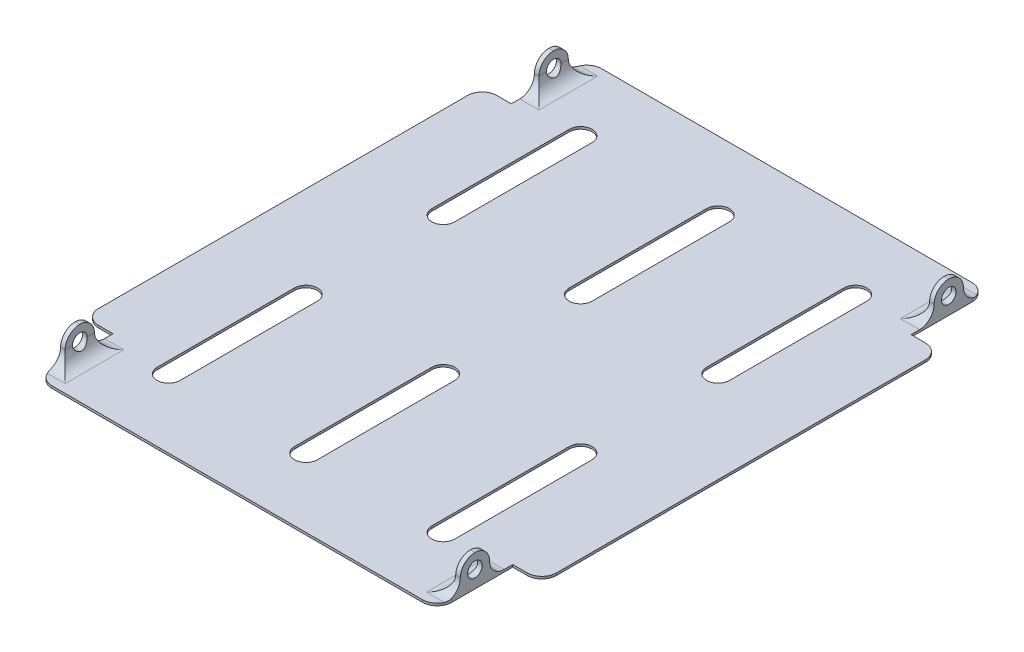
from build123d import *

# Parameters (mm, degrees)
BOSS_EXTRUDE1_DEPTH  = 5
CUT_EXTRUDE1_REACH   = 783.041
SKETCH3_W            = 64
SKETCH3_H            = 64
SKETCH3_R            = 16
BOSS_EXTRUDE2_DEPTH  = 10
FILLET1_R            = 32
FILLET1_OF_MIRROR1_R = 32
FILLET2_R            = 32


with BuildPart() as part:
    # Sketch1 → Boss-Extrude1 (new body)
    with BuildSketch(Plane(origin=(0, 0, 0), x_dir=(1, 0, 0), z_dir=(0, 1, 0))):
        Polygon((-436.5, -434.9), (-436.5, -600), (436.5, -600), (436.5, -434.9), (500, -434.9), (500, 434.9), (436.5, 434.9), (436.5, 600), (-436.5, 600), (-436.5, 434.9), (-500, 434.9), (-500, -434.9), align=None)
    extrude(amount=BOSS_EXTRUDE1_DEPTH)

    # Sketch2 → Cut-Extrude1 (cut, up to next)
    with BuildSketch(Plane(origin=(0, 5, 0), x_dir=(1, 0, 0), z_dir=(0, 1, 0)), mode=Mode.PRIVATE) as cut_extrude1_sk1:
        with BuildLine():
            Line((-275, -150), (-275, -450))
            ThreePointArc((-275, -450), (-300, -475), (-325, -450))
            Line((-325, -450), (-325, -150))
            ThreePointArc((-325, -150), (-300, -125), (-275, -150))
        make_face()
    cut_extrude1_tool1 = extrude(cut_extrude1_sk1.sketch, amount=-CUT_EXTRUDE1_REACH, mode=Mode.PRIVATE) & part.part
    # Sketch2 → Cut-Extrude1 (cut, up to next)
    with BuildSketch(Plane(origin=(0, 5, 0), x_dir=(1, 0, 0), z_dir=(0, 1, 0)), mode=Mode.PRIVATE) as cut_extrude1_sk2:
        with BuildLine():
            Line((-325, 150), (-325, 450))
            ThreePointArc((-325, 450), (-300, 475), (-275, 450))
            Line((-275, 450), (-275, 150))
            ThreePointArc((-275, 150), (-300, 125), (-325, 150))
        make_face()
    cut_extrude1_tool2 = extrude(cut_extrude1_sk2.sketch, amount=-CUT_EXTRUDE1_REACH, mode=Mode.PRIVATE) & part.part
    # Sketch2 → Cut-Extrude1 (cut, up to next)
    with BuildSketch(Plane(origin=(0, 5, 0), x_dir=(1, 0, 0), z_dir=(0, 1, 0)), mode=Mode.PRIVATE) as cut_extrude1_sk3:
        with BuildLine():
            Line((-25, 150), (-25, 450))
            ThreePointArc((-25, 450), (0, 475), (25, 450))
            Line((25, 450), (25, 150))
            ThreePointArc((25, 150), (0, 125), (-25, 150))
        make_face()
    cut_extrude1_tool3 = extrude(cut_extrude1_sk3.sketch, amount=-CUT_EXTRUDE1_REACH, mode=Mode.PRIVATE) & part.part
    # Sketch2 → Cut-Extrude1 (cut, up to next)
    with BuildSketch(Plane(origin=(0, 5, 0), x_dir=(1, 0, 0), z_dir=(0, 1, 0)), mode=Mode.PRIVATE) as cut_extrude1_sk4:
        with BuildLine():
            Line((25, -150), (25, -450))
            ThreePointArc((25, -450), (0, -475), (-25, -450))
            Line((-25, -450), (-25, -150))
            ThreePointArc((-25, -150), (0, -125), (25, -150))
        make_face()
    cut_extrude1_tool4 = extrude(cut_extrude1_sk4.sketch, amount=-CUT_EXTRUDE1_REACH, mode=Mode.PRIVATE) & part.part
    # Sketch2 → Cut-Extrude1 (cut, up to next)
    with BuildSketch(Plane(origin=(0, 5, 0), x_dir=(1, 0, 0), z_dir=(0, 1, 0)), mode=Mode.PRIVATE) as cut_extrude1_sk5:
        with BuildLine():
            Line((275, 150), (275, 450))
            ThreePointArc((275, 450), (300, 475), (325, 450))
            Line((325, 450), (325, 150))
            ThreePointArc((325, 150), (300, 125), (275, 150))
        make_face()
    cut_extrude1_tool5 = extrude(cut_extrude1_sk5.sketch, amount=-CUT_EXTRUDE1_REACH, mode=Mode.PRIVATE) & part.part
    # Sketch2 → Cut-Extrude1 (cut, up to next)
    with BuildSketch(Plane(origin=(0, 5, 0), x_dir=(1, 0, 0), z_dir=(0, 1, 0)), mode=Mode.PRIVATE) as cut_extrude1_sk6:
        with BuildLine():
            Line((325, -150), (325, -450))
            ThreePointArc((325, -450), (300, -475), (275, -450))
            Line((275, -450), (275, -150))
            ThreePointArc((275, -150), (300, -125), (325, -150))
        make_face()
    cut_extrude1_tool6 = extrude(cut_extrude1_sk6.sketch, amount=-CUT_EXTRUDE1_REACH, mode=Mode.PRIVATE) & part.part
    add(cut_extrude1_tool1.solids().sort_by_distance((-300, 5, 300))[0], mode=Mode.SUBTRACT)
    add(cut_extrude1_tool2.solids().sort_by_distance((-300, 5, -300))[0], mode=Mode.SUBTRACT)
    add(cut_extrude1_tool3.solids().sort_by_distance((0, 5, -300))[0], mode=Mode.SUBTRACT)
    add(cut_extrude1_tool4.solids().sort_by_distance((0, 5, 300))[0], mode=Mode.SUBTRACT)
    add(cut_extrude1_tool5.solids().sort_by_distance((300, 5, -300))[0], mode=Mode.SUBTRACT)
    add(cut_extrude1_tool6.solids().sort_by_distance((300, 5, 300))[0], mode=Mode.SUBTRACT)

    # Sketch3 → Boss-Extrude2 (add)
    # profile 1 of 2: a face of its own
    with BuildSketch(Plane(origin=(436.5, 0, 0), x_dir=(0, 0, -1), z_dir=(1, 0, 0))):
        with Locations((-517.45, 37)):
            Rectangle(SKETCH3_W, SKETCH3_H)
        with Locations((-517.45, 37)):
            Circle(SKETCH3_R, mode=Mode.SUBTRACT)
    # profile 2 of 2: a face of its own
    with BuildSketch(Plane(origin=(436.5, 0, 0), x_dir=(0, 0, -1), z_dir=(1, 0, 0))):
        with Locations((517.45, 37)):
            Rectangle(SKETCH3_W, SKETCH3_H)
        with Locations((517.45, 37)):
            Circle(SKETCH3_R, mode=Mode.SUBTRACT)
    boss_extrude2 = extrude(amount=-BOSS_EXTRUDE2_DEPTH)

    # Fillet1
    # the kernel refuses this fillet: 32 mm, written as the material it adds along each edge
    with BuildSketch(Plane(origin=(436.5, 5, -485.45), x_dir=(0, 0, 1), z_dir=(-1, 0, 0)), Plane(origin=(436.5, 5, 549.45), x_dir=(0, 0, 1), z_dir=(-1, 0, 0))) as fillet1_piece_1:
        with BuildLine():
            CenterArc((FILLET1_R, FILLET1_R), FILLET1_R, 180, 90)
            Line((0, FILLET1_R), (0, 0))
            Line((0, 0), (FILLET1_R, 0))
        make_face()
    extrude(amount=10)
    with BuildSketch(Plane(origin=(436.5, 5, -549.45), x_dir=(0, 0, -1), z_dir=(-1, 0, 0)), Plane(origin=(436.5, 5, 485.45), x_dir=(0, 0, -1), z_dir=(-1, 0, 0))) as fillet1_piece_2:
        with BuildLine():
            CenterArc((FILLET1_R, -FILLET1_R), FILLET1_R, 90, 90)
            Line((0, -FILLET1_R), (0, 0))
            Line((0, 0), (FILLET1_R, 0))
        make_face()
    extrude(amount=10)
    with BuildSketch(Plane(origin=(426.5, 5, 485.45), x_dir=(-1, 0, 0), z_dir=(0, 0, 1))) as fillet1_piece_3_section:
        with BuildLine():
            CenterArc((FILLET1_R, -FILLET1_R), FILLET1_R, 90, 90)
            Line((0, -FILLET1_R), (0, 0))
            Line((0, 0), (FILLET1_R, 0))
        make_face()
    fillet1_piece_3 = extrude(amount=64, mode=Mode.PRIVATE)
    fillet1_piece_3 = fillet1_piece_3 - Plane(origin=(418.973446598, 37, 517.45), x_dir=(0, 0, -1), z_dir=(1, 0, 0)) * Cylinder(16, 257, mode=Mode.PRIVATE)
    add(fillet1_piece_3)
    with BuildSketch(Plane(origin=(426.5, 5, -549.45), x_dir=(-1, 0, 0), z_dir=(0, 0, 1))) as fillet1_piece_4_section:
        with BuildLine():
            CenterArc((FILLET1_R, -FILLET1_R), FILLET1_R, 90, 90)
            Line((0, -FILLET1_R), (0, 0))
            Line((0, 0), (FILLET1_R, 0))
        make_face()
    fillet1_piece_4 = extrude(amount=64, mode=Mode.PRIVATE)
    fillet1_piece_4 = fillet1_piece_4 - Plane(origin=(418.973446599, 37, -517.45), x_dir=(0, 0, -1), z_dir=(1, 0, 0)) * Cylinder(16, 256, mode=Mode.PRIVATE)
    add(fillet1_piece_4)
    with BuildSketch(Plane(origin=(426.5, 5, -549.45), x_dir=(-1, 0, 0), z_dir=(0, 0, 1))) as fillet1_piece_5a_section:
        with BuildLine():
            CenterArc((FILLET1_R, -FILLET1_R), FILLET1_R, 90, 90)
            Line((0, -FILLET1_R), (0, 0))
            Line((0, 0), (FILLET1_R, 0))
        make_face()
    fillet1_piece_5a = extrude(amount=144, mode=Mode.PRIVATE)
    fillet1_piece_5a = split(fillet1_piece_5a, bisect_by=Plane(origin=(419.255356343, 12.244643657, -485.45), z_dir=(0, 0, 1)), keep=Keep.TOP, mode=Mode.PRIVATE)
    with BuildSketch(Plane(origin=(436.5, 5, -485.45), x_dir=(0, 0, 1), z_dir=(-1, 0, 0))) as fillet1_piece_5b_section:
        with BuildLine():
            CenterArc((FILLET1_R, FILLET1_R), FILLET1_R, 180, 90)
            Line((0, FILLET1_R), (0, 0))
            Line((0, 0), (FILLET1_R, 0))
        make_face()
    fillet1_piece_5b = extrude(amount=90, mode=Mode.PRIVATE)
    fillet1_piece_5b = split(fillet1_piece_5b, bisect_by=Plane(origin=(426.5, 12.244643657, -478.205356343), z_dir=(-1, 0, 0)), keep=Keep.TOP, mode=Mode.PRIVATE)
    fillet1_piece_5 = fillet1_piece_5a & fillet1_piece_5b
    add(fillet1_piece_5)
    with BuildSketch(Plane(origin=(436.5, 5, -549.45), x_dir=(0, 0, -1), z_dir=(-1, 0, 0))) as fillet1_piece_6a_section:
        with BuildLine():
            CenterArc((FILLET1_R, -FILLET1_R), FILLET1_R, 90, 90)
            Line((0, -FILLET1_R), (0, 0))
            Line((0, 0), (FILLET1_R, 0))
        make_face()
    fillet1_piece_6a = extrude(amount=90, mode=Mode.PRIVATE)
    fillet1_piece_6a = split(fillet1_piece_6a, bisect_by=Plane(origin=(426.5, 12.244643657, -556.694643657), z_dir=(-1, 0, 0)), keep=Keep.TOP, mode=Mode.PRIVATE)
    with BuildSketch(Plane(origin=(426.5, 5, -629.45), x_dir=(-1, 0, 0), z_dir=(0, 0, 1))) as fillet1_piece_6b_section:
        with BuildLine():
            CenterArc((FILLET1_R, -FILLET1_R), FILLET1_R, 90, 90)
            Line((0, -FILLET1_R), (0, 0))
            Line((0, 0), (FILLET1_R, 0))
        make_face()
    fillet1_piece_6b = extrude(amount=144, mode=Mode.PRIVATE)
    fillet1_piece_6b = split(fillet1_piece_6b, bisect_by=Plane(origin=(419.255356343, 12.244643657, -600), z_dir=(0, 0, 1)), keep=Keep.TOP, mode=Mode.PRIVATE)
    fillet1_piece_6b = split(fillet1_piece_6b, bisect_by=Plane(origin=(419.255356343, 12.244643657, -549.45), z_dir=(0, 0, -1)), keep=Keep.TOP, mode=Mode.PRIVATE)
    fillet1_piece_6 = fillet1_piece_6a & fillet1_piece_6b
    add(fillet1_piece_6)
    with BuildSketch(Plane(origin=(436.5, 5, 485.45), x_dir=(0, 0, -1), z_dir=(-1, 0, 0))) as fillet1_piece_7a_section:
        with BuildLine():
            CenterArc((FILLET1_R, -FILLET1_R), FILLET1_R, 90, 90)
            Line((0, -FILLET1_R), (0, 0))
            Line((0, 0), (FILLET1_R, 0))
        make_face()
    fillet1_piece_7a = extrude(amount=90, mode=Mode.PRIVATE)
    fillet1_piece_7a = split(fillet1_piece_7a, bisect_by=Plane(origin=(426.5, 12.244643657, 478.205356343), z_dir=(-1, 0, 0)), keep=Keep.TOP, mode=Mode.PRIVATE)
    with BuildSketch(Plane(origin=(426.5, 5, 405.45), x_dir=(-1, 0, 0), z_dir=(0, 0, 1))) as fillet1_piece_7b_section:
        with BuildLine():
            CenterArc((FILLET1_R, -FILLET1_R), FILLET1_R, 90, 90)
            Line((0, -FILLET1_R), (0, 0))
            Line((0, 0), (FILLET1_R, 0))
        make_face()
    fillet1_piece_7b = extrude(amount=144, mode=Mode.PRIVATE)
    fillet1_piece_7b = split(fillet1_piece_7b, bisect_by=Plane(origin=(419.255356343, 12.244643657, 485.45), z_dir=(0, 0, -1)), keep=Keep.TOP, mode=Mode.PRIVATE)
    fillet1_piece_7 = fillet1_piece_7a & fillet1_piece_7b
    add(fillet1_piece_7)
    with BuildSketch(Plane(origin=(426.5, 5, 485.45), x_dir=(-1, 0, 0), z_dir=(0, 0, 1))) as fillet1_piece_8a_section:
        with BuildLine():
            CenterArc((FILLET1_R, -FILLET1_R), FILLET1_R, 90, 90)
            Line((0, -FILLET1_R), (0, 0))
            Line((0, 0), (FILLET1_R, 0))
        make_face()
    fillet1_piece_8a = extrude(amount=144, mode=Mode.PRIVATE)
    fillet1_piece_8a = split(fillet1_piece_8a, bisect_by=Plane(origin=(419.255356343, 12.244643657, 600), z_dir=(0, 0, -1)), keep=Keep.TOP, mode=Mode.PRIVATE)
    fillet1_piece_8a = split(fillet1_piece_8a, bisect_by=Plane(origin=(419.255356343, 12.244643657, 549.45), z_dir=(0, 0, 1)), keep=Keep.TOP, mode=Mode.PRIVATE)
    with BuildSketch(Plane(origin=(436.5, 5, 549.45), x_dir=(0, 0, 1), z_dir=(-1, 0, 0))) as fillet1_piece_8b_section:
        with BuildLine():
            CenterArc((FILLET1_R, FILLET1_R), FILLET1_R, 180, 90)
            Line((0, FILLET1_R), (0, 0))
            Line((0, 0), (FILLET1_R, 0))
        make_face()
    fillet1_piece_8b = extrude(amount=90, mode=Mode.PRIVATE)
    fillet1_piece_8b = split(fillet1_piece_8b, bisect_by=Plane(origin=(426.5, 12.244643657, 556.694643657), z_dir=(-1, 0, 0)), keep=Keep.TOP, mode=Mode.PRIVATE)
    fillet1_piece_8 = fillet1_piece_8a & fillet1_piece_8b
    add(fillet1_piece_8)
    # the kernel refuses this fillet: 32 mm, written as the material it takes off along each edge
    with BuildSketch(Plane(origin=(516.5, 69, -485.45), x_dir=(0, 0, -1), z_dir=(-1, 0, 0)), Plane(origin=(516.5, 69, -549.45), x_dir=(0, -1, 0), z_dir=(-1, 0, 0)), Plane(origin=(516.5, 69, 549.45), x_dir=(0, 0, -1), z_dir=(-1, 0, 0)), Plane(origin=(516.5, 69, 485.45), x_dir=(0, -1, 0), z_dir=(-1, 0, 0))) as fillet1_2_piece_1:
        with BuildLine():
            CenterArc((FILLET1_R, FILLET1_R), FILLET1_R, 180, 90)
            Line((0, FILLET1_R), (0, 0))
            Line((0, 0), (FILLET1_R, 0))
        make_face()
    extrude(amount=170, mode=Mode.SUBTRACT)

    # Mirror1: Boss-Extrude2 across plane
    add(boss_extrude2.mirror(Plane(origin=(0, 0, 0), x_dir=(0, 0, 1), z_dir=(1, 0, 0))))

    # Fillet1 of Mirror1
    # the kernel refuses this fillet: 32 mm, written as the material it adds along each edge
    with BuildSketch(Plane(origin=(-436.5, 5, -485.45), x_dir=(0, 0, 1), z_dir=(1, 0, 0)), Plane(origin=(-436.5, 5, 549.45), x_dir=(0, 0, 1), z_dir=(1, 0, 0))) as fillet1_of_mirror1_piece_1:
        with BuildLine():
            CenterArc((FILLET1_OF_MIRROR1_R, -FILLET1_OF_MIRROR1_R), FILLET1_OF_MIRROR1_R, 90, 90)
            Line((0, -FILLET1_OF_MIRROR1_R), (0, 0))
            Line((0, 0), (FILLET1_OF_MIRROR1_R, 0))
        make_face()
    extrude(amount=10)
    with BuildSketch(Plane(origin=(-436.5, 5, -549.45), x_dir=(0, 0, -1), z_dir=(1, 0, 0)), Plane(origin=(-436.5, 5, 485.45), x_dir=(0, 0, -1), z_dir=(1, 0, 0))) as fillet1_of_mirror1_piece_2:
        with BuildLine():
            CenterArc((FILLET1_OF_MIRROR1_R, FILLET1_OF_MIRROR1_R), FILLET1_OF_MIRROR1_R, 180, 90)
            Line((0, FILLET1_OF_MIRROR1_R), (0, 0))
            Line((0, 0), (FILLET1_OF_MIRROR1_R, 0))
        make_face()
    extrude(amount=10)
    with BuildSketch(Plane(origin=(-426.5, 5, 485.45), x_dir=(1, 0, 0), z_dir=(0, 0, 1))) as fillet1_of_mirror1_piece_3_section:
        with BuildLine():
            CenterArc((FILLET1_OF_MIRROR1_R, FILLET1_OF_MIRROR1_R), FILLET1_OF_MIRROR1_R, 180, 90)
            Line((0, FILLET1_OF_MIRROR1_R), (0, 0))
            Line((0, 0), (FILLET1_OF_MIRROR1_R, 0))
        make_face()
    fillet1_of_mirror1_piece_3 = extrude(amount=64, mode=Mode.PRIVATE)
    fillet1_of_mirror1_piece_3 = fillet1_of_mirror1_piece_3 - Plane(origin=(-418.973446599, 37, 517.45), x_dir=(0, 0, -1), z_dir=(-1, 0, 0)) * Cylinder(16, 257, mode=Mode.PRIVATE)
    add(fillet1_of_mirror1_piece_3)
    with BuildSketch(Plane(origin=(-426.5, 5, -549.45), x_dir=(1, 0, 0), z_dir=(0, 0, 1))) as fillet1_of_mirror1_piece_4_section:
        with BuildLine():
            CenterArc((FILLET1_OF_MIRROR1_R, FILLET1_OF_MIRROR1_R), FILLET1_OF_MIRROR1_R, 180, 90)
            Line((0, FILLET1_OF_MIRROR1_R), (0, 0))
            Line((0, 0), (FILLET1_OF_MIRROR1_R, 0))
        make_face()
    fillet1_of_mirror1_piece_4 = extrude(amount=64, mode=Mode.PRIVATE)
    fillet1_of_mirror1_piece_4 = fillet1_of_mirror1_piece_4 - Plane(origin=(-418.973446599, 37, -517.45), x_dir=(0, 0, -1), z_dir=(-1, 0, 0)) * Cylinder(16, 256, mode=Mode.PRIVATE)
    add(fillet1_of_mirror1_piece_4)
    with BuildSketch(Plane(origin=(-436.5, 5, -485.45), x_dir=(0, 0, 1), z_dir=(1, 0, 0))) as fillet1_of_mirror1_piece_5a_section:
        with BuildLine():
            CenterArc((FILLET1_OF_MIRROR1_R, -FILLET1_OF_MIRROR1_R), FILLET1_OF_MIRROR1_R, 90, 90)
            Line((0, -FILLET1_OF_MIRROR1_R), (0, 0))
            Line((0, 0), (FILLET1_OF_MIRROR1_R, 0))
        make_face()
    fillet1_of_mirror1_piece_5a = extrude(amount=90, mode=Mode.PRIVATE)
    fillet1_of_mirror1_piece_5a = split(fillet1_of_mirror1_piece_5a, bisect_by=Plane(origin=(-426.5, 12.244643657, -478.205356343), z_dir=(1, 0, 0)), keep=Keep.TOP, mode=Mode.PRIVATE)
    with BuildSketch(Plane(origin=(-426.5, 5, -549.45), x_dir=(1, 0, 0), z_dir=(0, 0, 1))) as fillet1_of_mirror1_piece_5b_section:
        with BuildLine():
            CenterArc((FILLET1_OF_MIRROR1_R, FILLET1_OF_MIRROR1_R), FILLET1_OF_MIRROR1_R, 180, 90)
            Line((0, FILLET1_OF_MIRROR1_R), (0, 0))
            Line((0, 0), (FILLET1_OF_MIRROR1_R, 0))
        make_face()
    fillet1_of_mirror1_piece_5b = extrude(amount=144, mode=Mode.PRIVATE)
    fillet1_of_mirror1_piece_5b = split(fillet1_of_mirror1_piece_5b, bisect_by=Plane(origin=(-419.255356343, 12.244643657, -485.45), z_dir=(0, 0, 1)), keep=Keep.TOP, mode=Mode.PRIVATE)
    fillet1_of_mirror1_piece_5 = fillet1_of_mirror1_piece_5a & fillet1_of_mirror1_piece_5b
    add(fillet1_of_mirror1_piece_5)
    with BuildSketch(Plane(origin=(-426.5, 5, -629.45), x_dir=(1, 0, 0), z_dir=(0, 0, 1))) as fillet1_of_mirror1_piece_6a_section:
        with BuildLine():
            CenterArc((FILLET1_OF_MIRROR1_R, FILLET1_OF_MIRROR1_R), FILLET1_OF_MIRROR1_R, 180, 90)
            Line((0, FILLET1_OF_MIRROR1_R), (0, 0))
            Line((0, 0), (FILLET1_OF_MIRROR1_R, 0))
        make_face()
    fillet1_of_mirror1_piece_6a = extrude(amount=144, mode=Mode.PRIVATE)
    fillet1_of_mirror1_piece_6a = split(fillet1_of_mirror1_piece_6a, bisect_by=Plane(origin=(-419.255356343, 12.244643657, -600), z_dir=(0, 0, 1)), keep=Keep.TOP, mode=Mode.PRIVATE)
    fillet1_of_mirror1_piece_6a = split(fillet1_of_mirror1_piece_6a, bisect_by=Plane(origin=(-419.255356343, 12.244643657, -549.45), z_dir=(0, 0, -1)), keep=Keep.TOP, mode=Mode.PRIVATE)
    with BuildSketch(Plane(origin=(-436.5, 5, -549.45), x_dir=(0, 0, -1), z_dir=(1, 0, 0))) as fillet1_of_mirror1_piece_6b_section:
        with BuildLine():
            CenterArc((FILLET1_OF_MIRROR1_R, FILLET1_OF_MIRROR1_R), FILLET1_OF_MIRROR1_R, 180, 90)
            Line((0, FILLET1_OF_MIRROR1_R), (0, 0))
            Line((0, 0), (FILLET1_OF_MIRROR1_R, 0))
        make_face()
    fillet1_of_mirror1_piece_6b = extrude(amount=90, mode=Mode.PRIVATE)
    fillet1_of_mirror1_piece_6b = split(fillet1_of_mirror1_piece_6b, bisect_by=Plane(origin=(-426.5, 12.244643657, -556.694643657), z_dir=(1, 0, 0)), keep=Keep.TOP, mode=Mode.PRIVATE)
    fillet1_of_mirror1_piece_6 = fillet1_of_mirror1_piece_6a & fillet1_of_mirror1_piece_6b
    add(fillet1_of_mirror1_piece_6)
    with BuildSketch(Plane(origin=(-426.5, 5, 405.45), x_dir=(1, 0, 0), z_dir=(0, 0, 1))) as fillet1_of_mirror1_piece_7a_section:
        with BuildLine():
            CenterArc((FILLET1_OF_MIRROR1_R, FILLET1_OF_MIRROR1_R), FILLET1_OF_MIRROR1_R, 180, 90)
            Line((0, FILLET1_OF_MIRROR1_R), (0, 0))
            Line((0, 0), (FILLET1_OF_MIRROR1_R, 0))
        make_face()
    fillet1_of_mirror1_piece_7a = extrude(amount=144, mode=Mode.PRIVATE)
    fillet1_of_mirror1_piece_7a = split(fillet1_of_mirror1_piece_7a, bisect_by=Plane(origin=(-419.255356343, 12.244643657, 485.45), z_dir=(0, 0, -1)), keep=Keep.TOP, mode=Mode.PRIVATE)
    with BuildSketch(Plane(origin=(-436.5, 5, 485.45), x_dir=(0, 0, -1), z_dir=(1, 0, 0))) as fillet1_of_mirror1_piece_7b_section:
        with BuildLine():
            CenterArc((FILLET1_OF_MIRROR1_R, FILLET1_OF_MIRROR1_R), FILLET1_OF_MIRROR1_R, 180, 90)
            Line((0, FILLET1_OF_MIRROR1_R), (0, 0))
            Line((0, 0), (FILLET1_OF_MIRROR1_R, 0))
        make_face()
    fillet1_of_mirror1_piece_7b = extrude(amount=90, mode=Mode.PRIVATE)
    fillet1_of_mirror1_piece_7b = split(fillet1_of_mirror1_piece_7b, bisect_by=Plane(origin=(-426.5, 12.244643657, 478.205356343), z_dir=(1, 0, 0)), keep=Keep.TOP, mode=Mode.PRIVATE)
    fillet1_of_mirror1_piece_7 = fillet1_of_mirror1_piece_7a & fillet1_of_mirror1_piece_7b
    add(fillet1_of_mirror1_piece_7)
    with BuildSketch(Plane(origin=(-436.5, 5, 549.45), x_dir=(0, 0, 1), z_dir=(1, 0, 0))) as fillet1_of_mirror1_piece_8a_section:
        with BuildLine():
            CenterArc((FILLET1_OF_MIRROR1_R, -FILLET1_OF_MIRROR1_R), FILLET1_OF_MIRROR1_R, 90, 90)
            Line((0, -FILLET1_OF_MIRROR1_R), (0, 0))
            Line((0, 0), (FILLET1_OF_MIRROR1_R, 0))
        make_face()
    fillet1_of_mirror1_piece_8a = extrude(amount=90, mode=Mode.PRIVATE)
    fillet1_of_mirror1_piece_8a = split(fillet1_of_mirror1_piece_8a, bisect_by=Plane(origin=(-426.5, 12.244643657, 556.694643657), z_dir=(1, 0, 0)), keep=Keep.TOP, mode=Mode.PRIVATE)
    with BuildSketch(Plane(origin=(-426.5, 5, 485.45), x_dir=(1, 0, 0), z_dir=(0, 0, 1))) as fillet1_of_mirror1_piece_8b_section:
        with BuildLine():
            CenterArc((FILLET1_OF_MIRROR1_R, FILLET1_OF_MIRROR1_R), FILLET1_OF_MIRROR1_R, 180, 90)
            Line((0, FILLET1_OF_MIRROR1_R), (0, 0))
            Line((0, 0), (FILLET1_OF_MIRROR1_R, 0))
        make_face()
    fillet1_of_mirror1_piece_8b = extrude(amount=144, mode=Mode.PRIVATE)
    fillet1_of_mirror1_piece_8b = split(fillet1_of_mirror1_piece_8b, bisect_by=Plane(origin=(-419.255356343, 12.244643657, 600), z_dir=(0, 0, -1)), keep=Keep.TOP, mode=Mode.PRIVATE)
    fillet1_of_mirror1_piece_8b = split(fillet1_of_mirror1_piece_8b, bisect_by=Plane(origin=(-419.255356343, 12.244643657, 549.45), z_dir=(0, 0, 1)), keep=Keep.TOP, mode=Mode.PRIVATE)
    fillet1_of_mirror1_piece_8 = fillet1_of_mirror1_piece_8a & fillet1_of_mirror1_piece_8b
    add(fillet1_of_mirror1_piece_8)
    # the kernel refuses this fillet: 32 mm, written as the material it takes off along each edge
    with BuildSketch(Plane(origin=(-516.5, 69, -485.45), x_dir=(0, -1, 0), z_dir=(1, 0, 0)), Plane(origin=(-516.5, 69, 549.45), x_dir=(0, -1, 0), z_dir=(1, 0, 0))) as fillet1_of_mirror1_2_piece_1:
        with BuildLine():
            CenterArc((FILLET1_OF_MIRROR1_R, FILLET1_OF_MIRROR1_R), FILLET1_OF_MIRROR1_R, 180, 90)
            Line((0, FILLET1_OF_MIRROR1_R), (0, 0))
            Line((0, 0), (FILLET1_OF_MIRROR1_R, 0))
        make_face()
    extrude(amount=170, mode=Mode.SUBTRACT)
    with BuildSketch(Plane(origin=(-516.5, 69, -549.45), x_dir=(0, -1, 0), z_dir=(1, 0, 0)), Plane(origin=(-516.5, 69, 485.45), x_dir=(0, -1, 0), z_dir=(1, 0, 0))) as fillet1_of_mirror1_2_piece_2:
        with BuildLine():
            CenterArc((FILLET1_OF_MIRROR1_R, -FILLET1_OF_MIRROR1_R), FILLET1_OF_MIRROR1_R, 90, 90)
            Line((0, -FILLET1_OF_MIRROR1_R), (0, 0))
            Line((0, 0), (FILLET1_OF_MIRROR1_R, 0))
        make_face()
    extrude(amount=170, mode=Mode.SUBTRACT)

    # Fillet2
    fillet2_edges = [part.edges().sort_by_distance(p)[0] for p in [
        (436.5, 2.5, 600),
        (436.5, 2.5, -600),
        (-436.5, 2.5, -600),
        (-436.5, 2.5, 600),
        (-500, 2.5, 434.9),
        (-500, 2.5, -434.9),
        (500, 2.5, -434.9),
        (500, 2.5, 434.9),
    ]]
    fillet(fillet2_edges, radius=FILLET2_R)


solid = part.part
